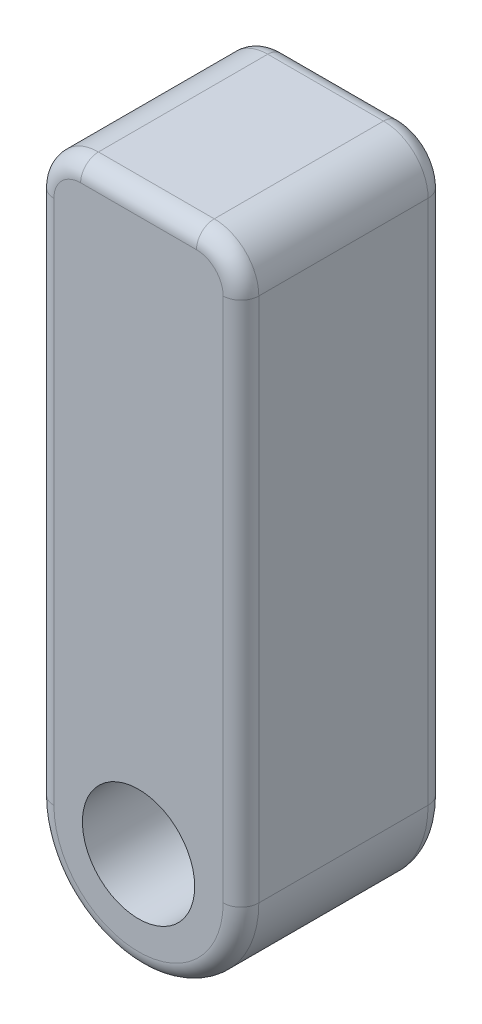
from build123d import *

# Parameters (mm, degrees)
SKETCH1_W           = 10.2
SKETCH1_H           = 15.2
SKETCH1_R           = 6.3
BOSS_EXTRUDE1_DEPTH = 23
CHAMFER2_SIZE       = 1
CHAMFER2_SIZE2      = 2.747477419
FILLET2_R           = 5
FILLET3_R           = 2
SKETCH2_W           = 10.2
SKETCH2_H           = 15.2
BOSS_EXTRUDE2_DEPTH = 1


with BuildPart() as part:
    # Sketch1 → Boss-Extrude1 (new body)
    with BuildSketch(Plane.XY):
        with BuildLine():
            Line((-11.5, 64), (-11.5, 4e-09))
            ThreePointArc((-11.5, 4e-09), (-2e-09, -11.5), (11.5, 0))
            Line((11.5, 0), (11.5, 64))
            Line((11.5, 64), (-11.5, 64))
        make_face()
        with Locations((0, 48.6)):
            Rectangle(SKETCH1_W, SKETCH1_H, mode=Mode.SUBTRACT)
        Circle(SKETCH1_R, mode=Mode.SUBTRACT)
    extrude(amount=BOSS_EXTRUDE1_DEPTH)

    # Chamfer2
    chamfer2_edges = [part.edges().sort_by_distance(p)[0] for p in [
        (5.1, 48.6, 0),
        (0, 41, 0),
        (-5.1, 48.6, 0),
        (0, 56.2, 0),
    ]]
    chamfer2_side = [part.faces().sort_by_distance(p)[0] for p in [
        (0, 27.539227836, 0),
    ]]
    chamfer(chamfer2_edges, length=CHAMFER2_SIZE, length2=CHAMFER2_SIZE2, reference=chamfer2_side[0])

    # Fillet2
    fillet2_edges = [part.edges().sort_by_distance(p)[0] for p in [
        (-11.5, 64, 11.5),
        (11.5, 64, 11.5),
    ]]
    fillet(fillet2_edges, radius=FILLET2_R)

    # Fillet3
    fillet3_edges = [part.edges().sort_by_distance(p)[0] for p in [
        (-2e-09, -11.5, 0),
        (11.5, 29.5, 0),
        (10.035533906, 62.535533906, 0),
        (0, 64, 0),
        (-10.035533906, 62.535533906, 0),
        (-2e-09, -11.5, 23),
        (11.5, 29.5, 23),
        (10.035533906, 62.535533906, 23),
        (0, 64, 23),
        (-10.035533906, 62.535533906, 23),
        (-11.5, 29.500000002, 0),
        (-11.5, 29.500000002, 23),
    ]]
    fillet(fillet3_edges, radius=FILLET3_R)

    # Sketch2 → Boss-Extrude2 (add)
    with BuildSketch(Plane.XY.offset(23)):
        with Locations((0, 48.6)):
            Rectangle(SKETCH2_W, SKETCH2_H)
    extrude(amount=-BOSS_EXTRUDE2_DEPTH)


solid = part.part
